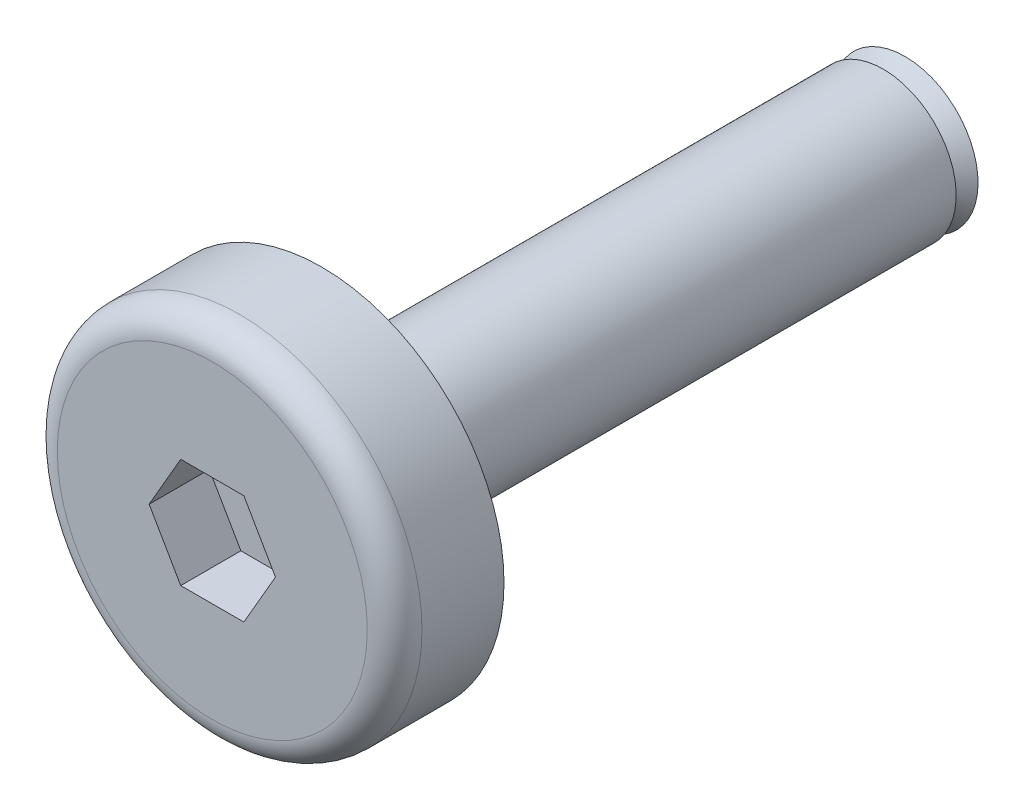
from build123d import *

# Parameters (mm, degrees)
F_0150_CYLINDER_SKETCH_R    = 2.5
F_0150_CYLINDER_DEPTH       = 1.5
F_0151_FILLET_R             = 0.375
F_0152_EXTRUDE_DEPTH        = 0.835
F_0152_EXTRUDE_ROTATE_ANGLE = 120
F_0155_CYLINDER_SKETCH_R    = 1
F_0155_CYLINDER_DEPTH       = 7.7
F_0156_CONE_ROTATE_ANGLE    = 90


with BuildPart() as part:
    # 0150_cylinder_Sketch → 0150_cylinder (new body)
    with BuildSketch(Plane.XY):
        Circle(F_0150_CYLINDER_SKETCH_R)
    extrude(amount=F_0150_CYLINDER_DEPTH)

    # 0151_fillet
    f_0151_fillet_edges = [part.edges().sort_by_distance(p)[0] for p in [
        (-2.5, 0, 1.5),
    ]]
    fillet(f_0151_fillet_edges, radius=F_0151_FILLET_R)


with BuildPart() as body_2:
    # 0152_extrude_Sketch → 0152_extrude (new body)
    with BuildSketch(Plane.XY):
        Polygon((0, 0), (0.866025404, 0), (1.299038106, 0.75), (0.866025404, 1.5), (0, 1.5), (-0.433012702, 0.75), align=None)
    extrude(amount=F_0152_EXTRUDE_DEPTH)


with BuildPart() as body_2_1:
    # 0152_extrude_Rotate: read off the stored shape, not the designer's step
    # 0152_extrude_Rotate: moved
    add(body_2.part.rotate(Axis((0, 0, 0), (0, 0, 1)), F_0152_EXTRUDE_ROTATE_ANGLE))


with BuildPart() as body_2_2:
    # 0152_extrude_Translate: moved
    add(body_2_1.part.moved(Location((0.866025404, 0, 0.675))))


with BuildPart() as part_1:
    add(part.part)

    # 0154_sub: cut body 2
    add(body_2_2.part, mode=Mode.SUBTRACT)


with BuildPart() as body_2_2_1:
    # 0155_cylinder_Sketch → 0155_cylinder (new body)
    with BuildSketch(Plane.XY):
        with Locations(Location((0, 0, 0), (0, 0, 180))):
            Circle(F_0155_CYLINDER_SKETCH_R)
    extrude(amount=F_0155_CYLINDER_DEPTH)


with BuildPart() as body_2_2_2:
    # 0155_cylinder_Translate: moved
    add(body_2_2_1.part.moved(Location((0, 0, -7.7))))


with BuildPart() as body_3:
    # 0156_cone_Sketch → 0156_cone (revolve)
    with BuildSketch(Plane.XY, mode=Mode.PRIVATE) as f_0156_cone_sk:
        Polygon((0, 0), (1, 0), (0.7, 0.3), (0, 0.3), align=None)
    revolve(f_0156_cone_sk.sketch.rotate(Axis((0, -100, 0), (0, 1, 0)), 90), axis=Axis((0, -100, 0), (0, 1, 0)))


with BuildPart() as body_3_1:
    # 0156_cone_Rotate: moved
    add(body_3.part.rotate(Axis((0, 0, 0), (1, 0, 0)), F_0156_CONE_ROTATE_ANGLE))


with BuildPart() as body_3_2:
    # 0156_cone_Translate: moved
    add(body_3_1.part.moved(Location((0, 0, -8))))


with BuildPart() as body_2_2_3:
    add(body_2_2_2.part)

    # 0158_add: union body 3
    add(body_3_2.part)


with BuildPart() as part_2:
    add(part_1.part)

    # 0159_add: union body 2 2
    add(body_2_2_3.part)


solid = part_2.part
